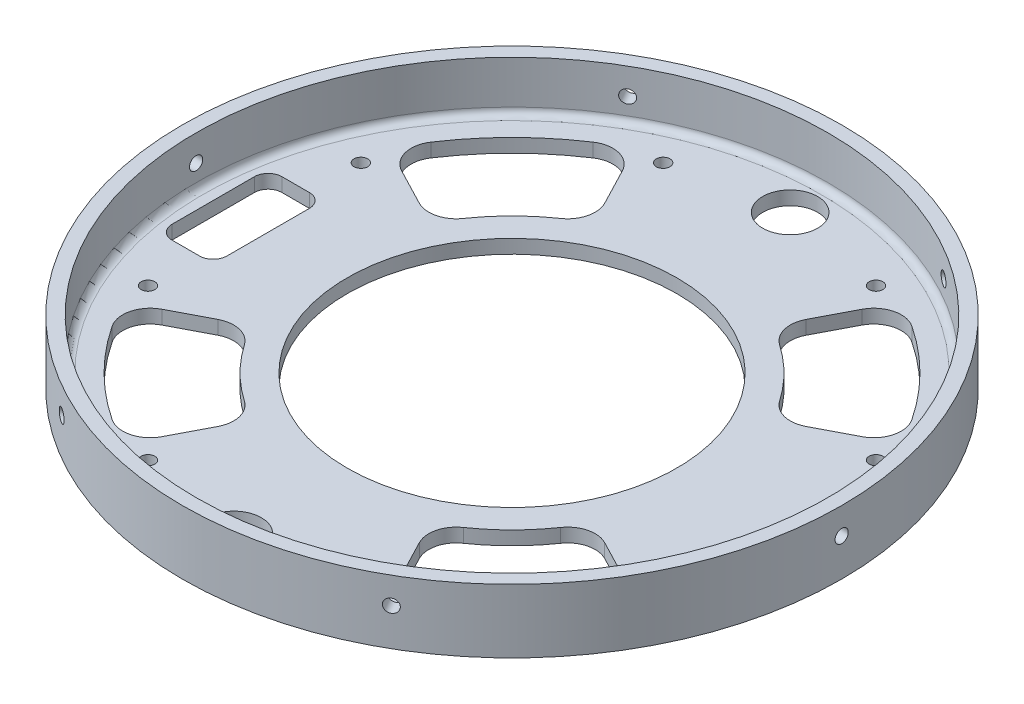
from build123d import *

# Parameters (mm, degrees)
SKETCH1_R           = 76.2
BOSS_EXTRUDE1_DEPTH = 16.256
SHELL1_T            = -3.175
FILLET1_R           = 1.5875
SKETCH2_R           = 38.1
CUT_EXTRUDE1_DEPTH  = 16.256
SKETCH3_R           = 1.524
CUT_EXTRUDE2_DEPTH  = 76.2
CIRPATTERN1_COUNT   = 6
CUT_EXTRUDE4_START  = -1.524
SKETCH5_R           = 76.2
CUT_EXTRUDE4_DEPTH  = 1.524
SKETCH6_R           = 6.35
CUT_EXTRUDE5_DEPTH  = 12.7
SKETCH7_R           = 1.5875
CUT_EXTRUDE6_DEPTH  = 6.35
SKETCH8_W           = 12.7
SKETCH8_H           = 25.4
CUT_EXTRUDE7_DEPTH  = 6.35
FILLET2_R           = 3.175
CUT_EXTRUDE8_DEPTH  = 6.35


with BuildPart() as part:
    # Sketch1 → Boss-Extrude1 (new body)
    with BuildSketch(Plane(origin=(0, 0, 0), x_dir=(1, 0, 0), z_dir=(0, 1, 0))):
        Circle(SKETCH1_R)
    extrude(amount=BOSS_EXTRUDE1_DEPTH)

    # Shell1
    shell1_openings = [part.faces().sort_by_distance(p)[0] for p in [
        (0, 16.256, 0),
    ]]
    offset(amount=SHELL1_T, openings=shell1_openings, kind=Kind.INTERSECTION)

    # Fillet1
    fillet1_edges = [part.edges().sort_by_distance(p)[0] for p in [
        (-73.025, 3.175, 0),
    ]]
    fillet(fillet1_edges, radius=FILLET1_R)

    # Sketch2 → Cut-Extrude1 (cut)
    with BuildSketch(Plane.XZ):
        Circle(SKETCH2_R)
    extrude(amount=-CUT_EXTRUDE1_DEPTH, mode=Mode.SUBTRACT)

    # Sketch3 → Cut-Extrude2 (cut)
    with BuildSketch(Plane(origin=(0, 0, 0), x_dir=(0, 0, -1), z_dir=(1, 0, 0))):
        with Locations((0, 8.636)):
            Circle(SKETCH3_R)
    cut_extrude2 = extrude(amount=-CUT_EXTRUDE2_DEPTH, mode=Mode.SUBTRACT)

    # CirPattern1: Cut-Extrude2 ×6 about axis
    cirpattern1_axis = Axis((0, 16.256, 0), (0, -1, 0))
    for i in range(1, CIRPATTERN1_COUNT):
        add(cut_extrude2.rotate(cirpattern1_axis, i * 360 / CIRPATTERN1_COUNT), mode=Mode.SUBTRACT)

    # Sketch5 → Cut-Extrude4 (cut)
    with BuildSketch(Plane(origin=(0, 16.256, 0), x_dir=(1, 0, 0), z_dir=(0, 1, 0)).offset(CUT_EXTRUDE4_START)):
        Circle(SKETCH5_R)
    extrude(amount=CUT_EXTRUDE4_DEPTH, mode=Mode.SUBTRACT)

    # Sketch6 → Cut-Extrude5 (cut)
    with BuildSketch(Plane(origin=(0, 3.175, 0), x_dir=(1, 0, 0), z_dir=(0, 1, 0))):
        with Locations((0, 64.2874)):
            Circle(SKETCH6_R)
        with Locations((0, -64.2874)):
            Circle(SKETCH6_R)
    extrude(amount=-CUT_EXTRUDE5_DEPTH, mode=Mode.SUBTRACT)

    # Sketch7 → Cut-Extrude6 (cut)
    with BuildSketch(Plane(origin=(0, 3.175, 0), x_dir=(1, 0, 0), z_dir=(0, 1, 0))):
        with Locations((-24.6, 59.525)):
            Circle(SKETCH7_R)
        with Locations((24.6, 59.525)):
            Circle(SKETCH7_R)
        with Locations((24.6, -59.525)):
            Circle(SKETCH7_R)
        with Locations((-24.6, -59.525)):
            Circle(SKETCH7_R)
        with Locations((-59.525, -24.6)):
            Circle(SKETCH7_R)
        with Locations((-59.525, 24.6)):
            Circle(SKETCH7_R)
        with Locations((59.525, 24.6)):
            Circle(SKETCH7_R)
        with Locations((59.525, -24.6)):
            Circle(SKETCH7_R)
    extrude(amount=-CUT_EXTRUDE6_DEPTH, mode=Mode.SUBTRACT)

    # Sketch8 → Cut-Extrude7 (cut)
    with BuildSketch(Plane(origin=(0, 3.175, 0), x_dir=(1, 0, 0), z_dir=(0, 1, 0))):
        with Locations((-62.7, 0)):
            Rectangle(SKETCH8_W, SKETCH8_H)
    extrude(amount=-CUT_EXTRUDE7_DEPTH, mode=Mode.SUBTRACT)

    # Fillet2
    fillet2_edges = [part.edges().sort_by_distance(p)[0] for p in [
        (-69.05, 1.5875, 12.7),
        (-56.35, 1.5875, 12.7),
        (-56.35, 1.5875, -12.7),
        (-69.05, 1.5875, -12.7),
    ]]
    fillet(fillet2_edges, radius=FILLET2_R)

    # Sketch9 → Cut-Extrude8 (cut)
    with BuildSketch(Plane(origin=(0, 3.175, 0), x_dir=(1, 0, 0), z_dir=(0, 1, 0))):
        with BuildLine():
            Line((-27.700233979, 53.211654386), (-23.272851578, 44.706731925))
            ThreePointArc((-23.272851578, 44.706731925), (-22.741576978, 40.248145008), (-25.292199073, 36.552799702))
            ThreePointArc((-25.292199073, 36.552799702), (-31.430896424, 31.430896424), (-36.552799702, 25.292199073))
            ThreePointArc((-36.552799702, 25.292199073), (-40.248145008, 22.741576978), (-44.706731925, 23.272851578))
            Line((-44.706731925, 23.272851578), (-53.211654386, 27.700233979))
            ThreePointArc((-53.211654386, 27.700233979), (-56.427875079, 31.745110735), (-55.572134976, 36.841463587))
            ThreePointArc((-55.572134976, 36.841463587), (-47.146344636, 47.146344636), (-36.841463587, 55.572134976))
            ThreePointArc((-36.841463587, 55.572134976), (-31.745110735, 56.427875079), (-27.700233979, 53.211654386))
        make_face()
        with BuildLine():
            Line((44.706731925, 23.272851578), (53.211654386, 27.700233979))
            ThreePointArc((53.211654386, 27.700233979), (56.427875079, 31.745110735), (55.572134976, 36.841463587))
            ThreePointArc((55.572134976, 36.841463587), (47.146344636, 47.146344636), (36.841463587, 55.572134976))
            ThreePointArc((36.841463587, 55.572134976), (31.745110735, 56.427875079), (27.700233979, 53.211654386))
            Line((27.700233979, 53.211654386), (23.272851578, 44.706731925))
            ThreePointArc((23.272851578, 44.706731925), (22.741576978, 40.248145008), (25.292199073, 36.552799702))
            ThreePointArc((25.292199073, 36.552799702), (31.430896424, 31.430896424), (36.552799702, 25.292199073))
            ThreePointArc((36.552799702, 25.292199073), (40.248145008, 22.741576978), (44.706731925, 23.272851578))
        make_face()
        with BuildLine():
            Line((27.700233979, -53.211654386), (23.272851578, -44.706731925))
            ThreePointArc((23.272851578, -44.706731925), (22.741576978, -40.248145008), (25.292199073, -36.552799702))
            ThreePointArc((25.292199073, -36.552799702), (31.430896424, -31.430896424), (36.552799702, -25.292199073))
            ThreePointArc((36.552799702, -25.292199073), (40.248145008, -22.741576978), (44.706731925, -23.272851578))
            Line((44.706731925, -23.272851578), (53.211654386, -27.700233979))
            ThreePointArc((53.211654386, -27.700233979), (56.427875079, -31.745110735), (55.572134976, -36.841463587))
            ThreePointArc((55.572134976, -36.841463587), (47.146344636, -47.146344636), (36.841463587, -55.572134976))
            ThreePointArc((36.841463587, -55.572134976), (31.745110735, -56.427875079), (27.700233979, -53.211654386))
        make_face()
        with BuildLine():
            Line((-44.706731925, -23.272851578), (-53.211654386, -27.700233979))
            ThreePointArc((-53.211654386, -27.700233979), (-56.427875079, -31.745110735), (-55.572134976, -36.841463587))
            ThreePointArc((-55.572134976, -36.841463587), (-47.146344636, -47.146344636), (-36.841463587, -55.572134976))
            ThreePointArc((-36.841463587, -55.572134976), (-31.745110735, -56.427875079), (-27.700233979, -53.211654386))
            Line((-27.700233979, -53.211654386), (-23.272851578, -44.706731925))
            ThreePointArc((-23.272851578, -44.706731925), (-22.741576978, -40.248145008), (-25.292199073, -36.552799702))
            ThreePointArc((-25.292199073, -36.552799702), (-31.430896424, -31.430896424), (-36.552799702, -25.292199073))
            ThreePointArc((-36.552799702, -25.292199073), (-40.248145008, -22.741576978), (-44.706731925, -23.272851578))
        make_face()
    extrude(amount=-CUT_EXTRUDE8_DEPTH, mode=Mode.SUBTRACT)


solid = part.part
